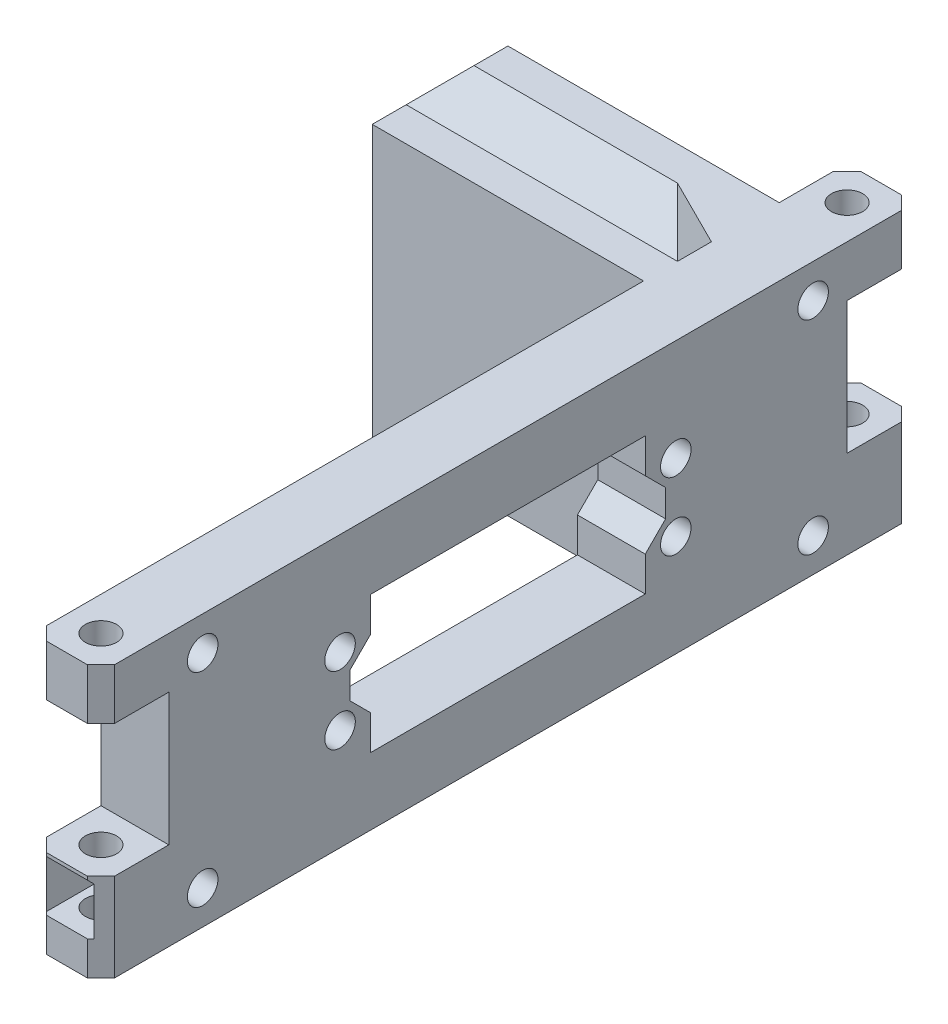
from build123d import *

# Parameters (mm, degrees)
SKETCH1_W                      = 60
SKETCH1_H                      = 100
SKETCH1_W_2                    = 40
SKETCH1_H_2                    = 80
EXTRUDE_THIN1_DEPTH            = 40
CUT_EXTRUDE1_REACH             = 72.711
SKETCH2_R                      = 2.25
CUT_EXTRUDE1_DIRECTION_2_REACH = 72.711
SKETCH3_W                      = 40
SKETCH3_H                      = 40
BOSS_EXTRUDE1_DEPTH            = 10
CUT_EXTRUDE2_START             = -30
SKETCH4_R                      = 2.25
CUT_EXTRUDE2_DEPTH             = 60
SKETCH5_W                      = 10
SKETCH5_H                      = 40
CUT_EXTRUDE3_DEPTH             = 112.803398875
CUT_EXTRUDE4_REACH             = 113.803
SKETCH6_W                      = 40
SKETCH6_H                      = 40
SKETCH7_W                      = 10
SKETCH7_H                      = 20
BOSS_EXTRUDE2_DEPTH            = 5
CHAMFER1_SIZE                  = 5
SKETCH8_W                      = 10
SKETCH8_H                      = 20
CUT_EXTRUDE5_DEPTH             = 5
CHAMFER2_SIZE                  = 5
SKETCH9_W                      = 3.5
SKETCH9_H                      = 7
CUT_EXTRUDE6_DEPTH             = 9
CHAMFER3_SIZE                  = 5
SKETCH10_W                     = 10
SKETCH10_H                     = 7.5
SKETCH10_H_2                   = 13
SKETCH10_W_2                   = 7
SKETCH10_H_3                   = 3.5
BOSS_EXTRUDE3_DEPTH            = 10
CUT_EXTRUDE7_REACH             = 76.54
SKETCH11_R                     = 2.3
CUT_EXTRUDE7_DIRECTION_2_DEPTH = 75.540257579
CHAMFER4_SIZE                  = 4
SKETCH12_R                     = 3.55
CUT_EXTRUDE8_DEPTH             = 2.5
CHAMFER5_SIZE                  = 2
SKETCH13_W                     = 40
SKETCH13_H                     = 5
CUT_EXTRUDE9_DEPTH             = 5
BOSS_EXTRUDE4_START            = -45
SKETCH13_2_W                   = 40
SKETCH13_2_H                   = 5
BOSS_EXTRUDE4_DEPTH            = 5
CHAMFER6_SIZE                  = 4.75
CHAMFER7_SIZE                  = 5
CUT_EXTRUDE10_DEPTH            = 5
CHAMFER8_SIZE                  = 3


# Some blends are built 0.0001 mm under size
with BuildPart() as part:
    # Sketch1 → Extrude-Thin1 (new body)
    with BuildSketch(Plane(origin=(0, 0, 0), x_dir=(1, 0, 0), z_dir=(0, 1, 0))):
        Rectangle(SKETCH1_W, SKETCH1_H)
        Rectangle(SKETCH1_W_2, SKETCH1_H_2, mode=Mode.SUBTRACT)
    extrude(amount=EXTRUDE_THIN1_DEPTH)

    # Sketch2 → Cut-Extrude1 (cut, up to next)
    with BuildSketch(Plane(origin=(0, 0, 0), x_dir=(0, 0, -1), z_dir=(1, 0, 0)), mode=Mode.PRIVATE) as cut_extrude1_sk1:
        with Locations(Location((-24.75, 15, 0), (0, 0, 180))):
            Circle(SKETCH2_R)
    cut_extrude1_tool1 = extrude(cut_extrude1_sk1.sketch, amount=-CUT_EXTRUDE1_REACH, mode=Mode.PRIVATE) & part.part
    # Sketch2 → Cut-Extrude1 (cut, up to next)
    with BuildSketch(Plane(origin=(0, 0, 0), x_dir=(0, 0, -1), z_dir=(1, 0, 0)), mode=Mode.PRIVATE) as cut_extrude1_sk2:
        with Locations(Location((-24.75, 25, 0), (0, 0, 180))):
            Circle(SKETCH2_R)
    cut_extrude1_tool2 = extrude(cut_extrude1_sk2.sketch, amount=-CUT_EXTRUDE1_REACH, mode=Mode.PRIVATE) & part.part
    # Sketch2 → Cut-Extrude1 (cut, up to next)
    with BuildSketch(Plane(origin=(0, 0, 0), x_dir=(0, 0, -1), z_dir=(1, 0, 0)), mode=Mode.PRIVATE) as cut_extrude1_sk3:
        with Locations(Location((24.75, 25, 0), (0, 0, 180))):
            Circle(SKETCH2_R)
    cut_extrude1_tool3 = extrude(cut_extrude1_sk3.sketch, amount=-CUT_EXTRUDE1_REACH, mode=Mode.PRIVATE) & part.part
    # Sketch2 → Cut-Extrude1 (cut, up to next)
    with BuildSketch(Plane(origin=(0, 0, 0), x_dir=(0, 0, -1), z_dir=(1, 0, 0)), mode=Mode.PRIVATE) as cut_extrude1_sk4:
        with Locations(Location((24.75, 15, 0), (0, 0, 180))):
            Circle(SKETCH2_R)
    cut_extrude1_tool4 = extrude(cut_extrude1_sk4.sketch, amount=-CUT_EXTRUDE1_REACH, mode=Mode.PRIVATE) & part.part
    # Sketch2 → Cut-Extrude1 (cut, up to next)
    with BuildSketch(Plane(origin=(0, 0, 0), x_dir=(0, 0, -1), z_dir=(1, 0, 0)), mode=Mode.PRIVATE) as cut_extrude1_sk5:
        Polygon((-20.25, 30.1), (20.25, 30.1), (20.25, 22), (23.25, 22), (23.25, 18), (20.25, 18), (20.25, 9.9), (-20.25, 9.9), (-20.25, 18), (-23.25, 18), (-23.25, 22), (-20.25, 22), align=None)
    cut_extrude1_tool5 = extrude(cut_extrude1_sk5.sketch, amount=-CUT_EXTRUDE1_REACH, mode=Mode.PRIVATE) & part.part
    add(cut_extrude1_tool1.solids().sort_by_distance((0, 15, 24.75))[0], mode=Mode.SUBTRACT)
    add(cut_extrude1_tool2.solids().sort_by_distance((0, 25, 24.75))[0], mode=Mode.SUBTRACT)
    add(cut_extrude1_tool3.solids().sort_by_distance((0, 25, -24.75))[0], mode=Mode.SUBTRACT)
    add(cut_extrude1_tool4.solids().sort_by_distance((0, 15, -24.75))[0], mode=Mode.SUBTRACT)
    add(cut_extrude1_tool5.solids().sort_by_distance((0, 20, 0))[0], mode=Mode.SUBTRACT)

    # Sketch2 → Cut-Extrude1 direction 2 (cut, up to next)
    with BuildSketch(Plane(origin=(0, 0, 0), x_dir=(0, 0, -1), z_dir=(1, 0, 0)), mode=Mode.PRIVATE) as cut_extrude1_direction_2_sk1:
        with Locations(Location((-24.75, 15, 0), (0, 0, 180))):
            Circle(SKETCH2_R)
    cut_extrude1_direction_2_tool1 = extrude(cut_extrude1_direction_2_sk1.sketch, amount=CUT_EXTRUDE1_DIRECTION_2_REACH, mode=Mode.PRIVATE) & part.part
    # Sketch2 → Cut-Extrude1 direction 2 (cut, up to next)
    with BuildSketch(Plane(origin=(0, 0, 0), x_dir=(0, 0, -1), z_dir=(1, 0, 0)), mode=Mode.PRIVATE) as cut_extrude1_direction_2_sk2:
        with Locations(Location((-24.75, 25, 0), (0, 0, 180))):
            Circle(SKETCH2_R)
    cut_extrude1_direction_2_tool2 = extrude(cut_extrude1_direction_2_sk2.sketch, amount=CUT_EXTRUDE1_DIRECTION_2_REACH, mode=Mode.PRIVATE) & part.part
    # Sketch2 → Cut-Extrude1 direction 2 (cut, up to next)
    with BuildSketch(Plane(origin=(0, 0, 0), x_dir=(0, 0, -1), z_dir=(1, 0, 0)), mode=Mode.PRIVATE) as cut_extrude1_direction_2_sk3:
        with Locations(Location((24.75, 25, 0), (0, 0, 180))):
            Circle(SKETCH2_R)
    cut_extrude1_direction_2_tool3 = extrude(cut_extrude1_direction_2_sk3.sketch, amount=CUT_EXTRUDE1_DIRECTION_2_REACH, mode=Mode.PRIVATE) & part.part
    # Sketch2 → Cut-Extrude1 direction 2 (cut, up to next)
    with BuildSketch(Plane(origin=(0, 0, 0), x_dir=(0, 0, -1), z_dir=(1, 0, 0)), mode=Mode.PRIVATE) as cut_extrude1_direction_2_sk4:
        with Locations(Location((24.75, 15, 0), (0, 0, 180))):
            Circle(SKETCH2_R)
    cut_extrude1_direction_2_tool4 = extrude(cut_extrude1_direction_2_sk4.sketch, amount=CUT_EXTRUDE1_DIRECTION_2_REACH, mode=Mode.PRIVATE) & part.part
    # Sketch2 → Cut-Extrude1 direction 2 (cut, up to next)
    with BuildSketch(Plane(origin=(0, 0, 0), x_dir=(0, 0, -1), z_dir=(1, 0, 0)), mode=Mode.PRIVATE) as cut_extrude1_direction_2_sk5:
        Polygon((-20.25, 30.1), (20.25, 30.1), (20.25, 22), (23.25, 22), (23.25, 18), (20.25, 18), (20.25, 9.9), (-20.25, 9.9), (-20.25, 18), (-23.25, 18), (-23.25, 22), (-20.25, 22), align=None)
    cut_extrude1_direction_2_tool5 = extrude(cut_extrude1_direction_2_sk5.sketch, amount=CUT_EXTRUDE1_DIRECTION_2_REACH, mode=Mode.PRIVATE) & part.part
    add(cut_extrude1_direction_2_tool1.solids().sort_by_distance((0, 15, 24.75))[0], mode=Mode.SUBTRACT)
    add(cut_extrude1_direction_2_tool2.solids().sort_by_distance((0, 25, 24.75))[0], mode=Mode.SUBTRACT)
    add(cut_extrude1_direction_2_tool3.solids().sort_by_distance((0, 25, -24.75))[0], mode=Mode.SUBTRACT)
    add(cut_extrude1_direction_2_tool4.solids().sort_by_distance((0, 15, -24.75))[0], mode=Mode.SUBTRACT)
    add(cut_extrude1_direction_2_tool5.solids().sort_by_distance((0, 20, 0))[0], mode=Mode.SUBTRACT)

    # Sketch3 → Boss-Extrude1 (add)
    with BuildSketch(Plane.XY.offset(-40)):
        with Locations((0, 20)):
            Rectangle(SKETCH3_W, SKETCH3_H)
    boss_extrude1 = extrude(amount=BOSS_EXTRUDE1_DEPTH)

    # Mirror1: Boss-Extrude1 across plane
    add(boss_extrude1.mirror(Plane.XY))

    # Sketch4 → Cut-Extrude2 (cut)
    with BuildSketch(Plane(origin=(0, 0, 0), x_dir=(0, 0, -1), z_dir=(1, 0, 0)).offset(CUT_EXTRUDE2_START)):
        with Locations((45, 5)):
            Circle(SKETCH4_R)
        with Locations((45, 35)):
            Circle(SKETCH4_R)
    cut_extrude2 = extrude(amount=CUT_EXTRUDE2_DEPTH, mode=Mode.SUBTRACT)

    # Mirror2: Cut-Extrude2 across plane
    add(cut_extrude2.mirror(Plane.XY), mode=Mode.SUBTRACT)

    # Sketch5 → Cut-Extrude3 (cut, through all)
    with BuildSketch(Plane(origin=(0, 0, -50), x_dir=(-1, 0, 0), z_dir=(0, 0, -1))):
        with Locations((25, 20)):
            Rectangle(SKETCH5_W, SKETCH5_H)
    extrude(amount=-CUT_EXTRUDE3_DEPTH, mode=Mode.SUBTRACT)

    # Sketch6 → Cut-Extrude4 (cut, up to next)
    with BuildSketch(Plane.XY.offset(50), mode=Mode.PRIVATE) as cut_extrude4_sk1:
        with Locations((0, 20)):
            Rectangle(SKETCH6_W, SKETCH6_H)
    cut_extrude4_tool1 = extrude(cut_extrude4_sk1.sketch, amount=-CUT_EXTRUDE4_REACH, mode=Mode.PRIVATE) & part.part
    add(cut_extrude4_tool1.solids().sort_by_distance((0, 20, 50))[0], mode=Mode.SUBTRACT)

    # Sketch7 → Boss-Extrude2 (add)
    with BuildSketch(Plane.ZY.offset(20)):
        with Locations((-40, 20)):
            Rectangle(SKETCH7_W, SKETCH7_H)
    extrude(amount=BOSS_EXTRUDE2_DEPTH)

    # Chamfer1
    chamfer1_edges = [part.edges().sort_by_distance(p)[0] for p in [
        (-25, 20, -35),
        (-25, 20, -45),
    ]]
    chamfer(chamfer1_edges, length=CHAMFER1_SIZE - 0.0001)  # a hair under: the kernel refuses the full size

    # Sketch8 → Cut-Extrude5 (cut)
    with BuildSketch(Plane.ZY.offset(-20)):
        with Locations((40, 20)):
            Rectangle(SKETCH8_W, SKETCH8_H)
    extrude(amount=-CUT_EXTRUDE5_DEPTH, mode=Mode.SUBTRACT)

    # Chamfer2
    chamfer2_edges = [part.edges().sort_by_distance(p)[0] for p in [
        (25, 20, 45),
        (25, 20, 35),
    ]]
    chamfer(chamfer2_edges, length=CHAMFER2_SIZE - 0.0001)  # a hair under: the kernel refuses the full size

    # Sketch9 → Cut-Extrude6 (cut)
    with BuildSketch(Plane(origin=(0, 0, -50), x_dir=(-1, 0, 0), z_dir=(0, 0, -1))):
        with Locations((-8.25, 35)):
            Rectangle(SKETCH9_W, SKETCH9_H)
        with Locations((-8.25, 5)):
            Rectangle(SKETCH9_W, SKETCH9_H)
    cut_extrude6 = extrude(amount=-CUT_EXTRUDE6_DEPTH, mode=Mode.SUBTRACT)

    # Mirror3: Cut-Extrude6 across plane
    add(cut_extrude6.mirror(Plane(origin=(0, 0, 0), x_dir=(0, 0, 1), z_dir=(1, 0, 0))), mode=Mode.SUBTRACT)

    # Chamfer3
    # the kernel refuses this chamfer: 5 mm, written as the material it takes off along each edge
    with BuildSketch(Plane(origin=(6.5, 38.5, -50), x_dir=(-0.9996219169112968, 0, -0.027495876610586317), z_dir=(0, -1, 0)), Plane(origin=(-10, 8.5, -50), x_dir=(-0.9996219169112968, 0, -0.02749587661058493), z_dir=(0, -1, 0))) as chamfer3_piece_1:
        Polygon((CHAMFER3_SIZE * 0.999621916911, -CHAMFER3_SIZE * 0.0274958766106), (-CHAMFER3_SIZE * 0.0274958766106, -CHAMFER3_SIZE * 0.999621916911), (0, 0), align=None)
    extrude(amount=7, mode=Mode.SUBTRACT)
    with BuildSketch(Plane(origin=(6.5, 1.5, -50), x_dir=(-0.9996219169112968, 0, -0.027495876610586313), z_dir=(0, 1, 0)), Plane(origin=(-10, 31.5, -50), x_dir=(-0.9996219169112968, 0, -0.02749587661058493), z_dir=(0, 1, 0))) as chamfer3_piece_2:
        Polygon((CHAMFER3_SIZE * 0.999621916911, CHAMFER3_SIZE * 0.0274958766106), (-CHAMFER3_SIZE * 0.0274958766106, CHAMFER3_SIZE * 0.999621916911), (0, 0), align=None)
    extrude(amount=7, mode=Mode.SUBTRACT)

    # Sketch10 → Boss-Extrude3 (add)
    # profile 1 of 2: a face of its own
    with BuildSketch(Plane.XY.offset(50)):
        with Locations((25, 36.25)):
            Rectangle(SKETCH10_W, SKETCH10_H)
    # profile 2 of 2: a face of its own
    with BuildSketch(Plane.XY.offset(50)):
        with Locations((25, 6.5)):
            Rectangle(SKETCH10_W, SKETCH10_H_2)
        with Locations((25, 6.75)):
            Rectangle(SKETCH10_W_2, SKETCH10_H_3, mode=Mode.SUBTRACT)
    boss_extrude3 = extrude(amount=BOSS_EXTRUDE3_DEPTH)

    # Sketch11 → Cut-Extrude7 (cut, up to next)
    with BuildSketch(Plane(origin=(0, 32.5, 0), x_dir=(-1, 0, 0), z_dir=(0, -1, 0)), mode=Mode.PRIVATE) as cut_extrude7_sk1:
        with Locations((-25, -55)):
            Circle(SKETCH11_R)
    cut_extrude7_tool1 = extrude(cut_extrude7_sk1.sketch, amount=-CUT_EXTRUDE7_REACH, mode=Mode.PRIVATE) & part.part
    cut_extrude7 = cut_extrude7_tool1.solids().sort_by_distance((25, 32.5, 55))[0]
    add(cut_extrude7, mode=Mode.SUBTRACT)

    # Sketch11 → Cut-Extrude7 direction 2 (cut)
    with BuildSketch(Plane(origin=(0, 32.5, 0), x_dir=(-1, 0, 0), z_dir=(0, -1, 0))):
        with Locations((-25, -55)):
            Circle(SKETCH11_R)
    cut_extrude7_direction_2 = extrude(amount=CUT_EXTRUDE7_DIRECTION_2_DEPTH, mode=Mode.SUBTRACT)

    # Mirror4: Boss-Extrude3 across plane
    add(boss_extrude3.mirror(Plane.XY))

    # Mirror5: Cut-Extrude7, Cut-Extrude7 direction 2 across plane
    add(cut_extrude7.mirror(Plane.XY), mode=Mode.SUBTRACT)
    add(cut_extrude7_direction_2.mirror(Plane.XY), mode=Mode.SUBTRACT)

    # Chamfer4
    # the kernel refuses this chamfer: 4 mm, written as the material it takes off along each edge
    with BuildSketch(Plane(origin=(28.5, 8.5, 60), x_dir=(0, 0.9996219169112968, 0.027495876610585623), z_dir=(-1, 0, 0))) as chamfer4_piece_1:
        Polygon((CHAMFER4_SIZE * 0.999621916911, CHAMFER4_SIZE * 0.0274958766106), (-CHAMFER4_SIZE * 0.0274958766106, CHAMFER4_SIZE * 0.999621916911), (0, 0), align=None)
    extrude(amount=7, mode=Mode.SUBTRACT)
    with BuildSketch(Plane(origin=(28.5, 8.5, -60), x_dir=(0, 0.9996219169112968, -0.027495876610585623), z_dir=(-1, 0, 0))) as chamfer4_piece_2:
        Polygon((CHAMFER4_SIZE * 0.999621916911, -CHAMFER4_SIZE * 0.0274958766106), (-CHAMFER4_SIZE * 0.0274958766106, -CHAMFER4_SIZE * 0.999621916911), (0, 0), align=None)
    extrude(amount=7, mode=Mode.SUBTRACT)

    # Sketch12 → Cut-Extrude8 (cut)
    with BuildSketch(Plane(origin=(0, 32.5, 0), x_dir=(-1, 0, 0), z_dir=(0, -1, 0))):
        with Locations(Location((-25, -55, 0), (0, 0, 90))):
            Circle(SKETCH12_R)
    cut_extrude8 = extrude(amount=-CUT_EXTRUDE8_DEPTH, mode=Mode.SUBTRACT)

    # Mirror6: Cut-Extrude8 across Front Plane
    add(cut_extrude8.mirror(Plane.XY), mode=Mode.SUBTRACT)

    # Chamfer5
    # the kernel refuses this chamfer: 2 mm, written as the material it takes off along each edge
    with BuildSketch(Plane(origin=(20, 45.143365976, 60), x_dir=(-0.027495876610585647, 0, -0.9996219169112968), z_dir=(0, -1, 0)), Plane(origin=(20, 45.143365976, -60), x_dir=(0.9996219169112968, -3.3146124273169054e-15, -0.027495876610585647), z_dir=(0, -1, 0))) as chamfer5_piece_1:
        Polygon((CHAMFER5_SIZE * 0.999621916911, CHAMFER5_SIZE * 0.0274958766106), (-CHAMFER5_SIZE * 0.0274958766106, CHAMFER5_SIZE * 0.999621916911), (0, 0), align=None)
    extrude(amount=17.786731952, mode=Mode.SUBTRACT)
    with BuildSketch(Plane(origin=(30, 27.356634024, 60), x_dir=(-0.9996219169112968, 0, 0.027495876610585647), z_dir=(0, 1, 0)), Plane(origin=(30, 27.356634024, -60), x_dir=(0.027495876610585647, 0, 0.9996219169112968), z_dir=(0, 1, 0))) as chamfer5_piece_2:
        Polygon((CHAMFER5_SIZE * 0.999621916911, -CHAMFER5_SIZE * 0.0274958766106), (-CHAMFER5_SIZE * 0.0274958766106, -CHAMFER5_SIZE * 0.999621916911), (0, 0), align=None)
    extrude(amount=17.786731952, mode=Mode.SUBTRACT)
    with BuildSketch(Plane(origin=(20, 18.143365976, 60), x_dir=(-0.027495876610585647, 0, -0.9996219169112968), z_dir=(0, -1, 0)), Plane(origin=(20, 18.143365976, -60), x_dir=(0.9996219169112968, 0, -0.027495876610585647), z_dir=(0, -1, 0))) as chamfer5_piece_3:
        Polygon((CHAMFER5_SIZE * 0.999621916911, CHAMFER5_SIZE * 0.0274958766106), (-CHAMFER5_SIZE * 0.0274958766106, CHAMFER5_SIZE * 0.999621916911), (0, 0), align=None)
    extrude(amount=23.286731952, mode=Mode.SUBTRACT)
    with BuildSketch(Plane(origin=(30, -5.143365976, 60), x_dir=(-0.9996219169112968, 0, 0.027495876610585647), z_dir=(0, 1, 0)), Plane(origin=(30, -5.143365976, -60), x_dir=(0.027495876610585647, 0, 0.9996219169112968), z_dir=(0, 1, 0))) as chamfer5_piece_4:
        Polygon((CHAMFER5_SIZE * 0.999621916911, -CHAMFER5_SIZE * 0.0274958766106), (-CHAMFER5_SIZE * 0.0274958766106, -CHAMFER5_SIZE * 0.999621916911), (0, 0), align=None)
    extrude(amount=23.286731952, mode=Mode.SUBTRACT)

    # Sketch13 → Cut-Extrude9 (cut)
    with BuildSketch(Plane(origin=(0, 0, 0), x_dir=(-1, 0, 0), z_dir=(0, -1, 0))):
        with Locations((0, 37.5)):
            Rectangle(SKETCH13_W, SKETCH13_H)
    extrude(amount=-CUT_EXTRUDE9_DEPTH, mode=Mode.SUBTRACT)

    # Sketch13<2> → Boss-Extrude4 (add)
    with BuildSketch(Plane(origin=(0, 0, 0), x_dir=(-1, 0, 0), z_dir=(0, -1, 0)).offset(BOSS_EXTRUDE4_START)):
        with Locations((0, 37.5)):
            Rectangle(SKETCH13_2_W, SKETCH13_2_H)
    extrude(amount=BOSS_EXTRUDE4_DEPTH)

    # Chamfer6
    chamfer6_edges = [part.edges().sort_by_distance(p)[0] for p in [
        (0, 5, -35),
    ]]
    chamfer(chamfer6_edges, length=CHAMFER6_SIZE)

    # Chamfer7
    chamfer7_edges = [part.edges().sort_by_distance(p)[0] for p in [
        (0, 45, -35),
    ]]
    chamfer(chamfer7_edges, length=CHAMFER7_SIZE - 0.0001)  # a hair under: the kernel refuses the full size

    # Sketch14 → Cut-Extrude10 (cut)
    with BuildSketch(Plane(origin=(0, 0, -40), x_dir=(-1, 0, 0), z_dir=(0, 0, -1))):
        Polygon((-20, 45), (-15, 45), (-20, 40), align=None)
        Polygon((20, 45), (15, 45), (20, 40), align=None)
    extrude(amount=-CUT_EXTRUDE10_DEPTH, mode=Mode.SUBTRACT)

    # Chamfer8
    chamfer8_edges = [part.edges().sort_by_distance(p)[0] for p in [
        (25, 18, -20.25),
        (25, 22, -20.25),
        (25, 18, 20.25),
        (25, 22, 20.25),
    ]]
    chamfer(chamfer8_edges, length=CHAMFER8_SIZE - 0.0001)  # a hair under: the kernel refuses the full size


solid = part.part
